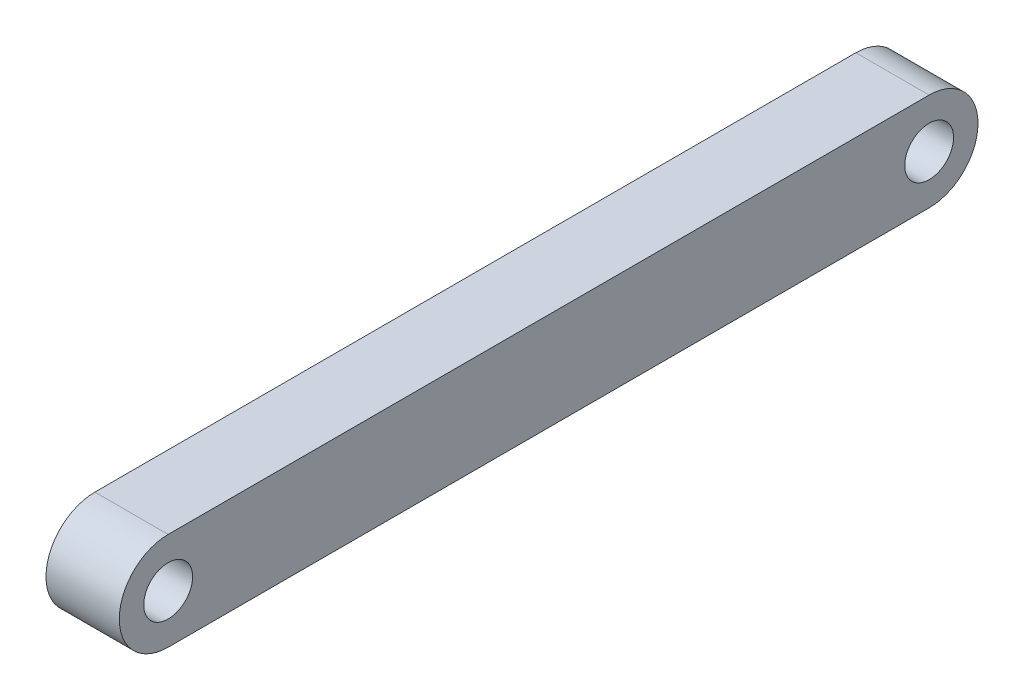
from build123d import *

# Parameters (mm, degrees)
SKETCH1_R           = 1
BOSS_EXTRUDE1_DEPTH = 1.5


with BuildPart() as part:
    # Sketch1 → Boss-Extrude1 (new, symmetric)
    with BuildSketch(Plane(origin=(0, 0, 0), x_dir=(0, 0, -1), z_dir=(1, 0, 0))):
        with BuildLine():
            Line((-15.575, -2), (15.575, -2))
            ThreePointArc((15.575, -2), (17.575, 0), (15.575, 2))
            Line((15.575, 2), (-15.575, 2))
            ThreePointArc((-15.575, 2), (-17.575, 0), (-15.575, -2))
        make_face()
        with Locations((-15.575, 0)):
            Circle(SKETCH1_R, mode=Mode.SUBTRACT)
        with Locations((15.575, 0)):
            Circle(SKETCH1_R, mode=Mode.SUBTRACT)
    extrude(amount=BOSS_EXTRUDE1_DEPTH, both=True)


solid = part.part
